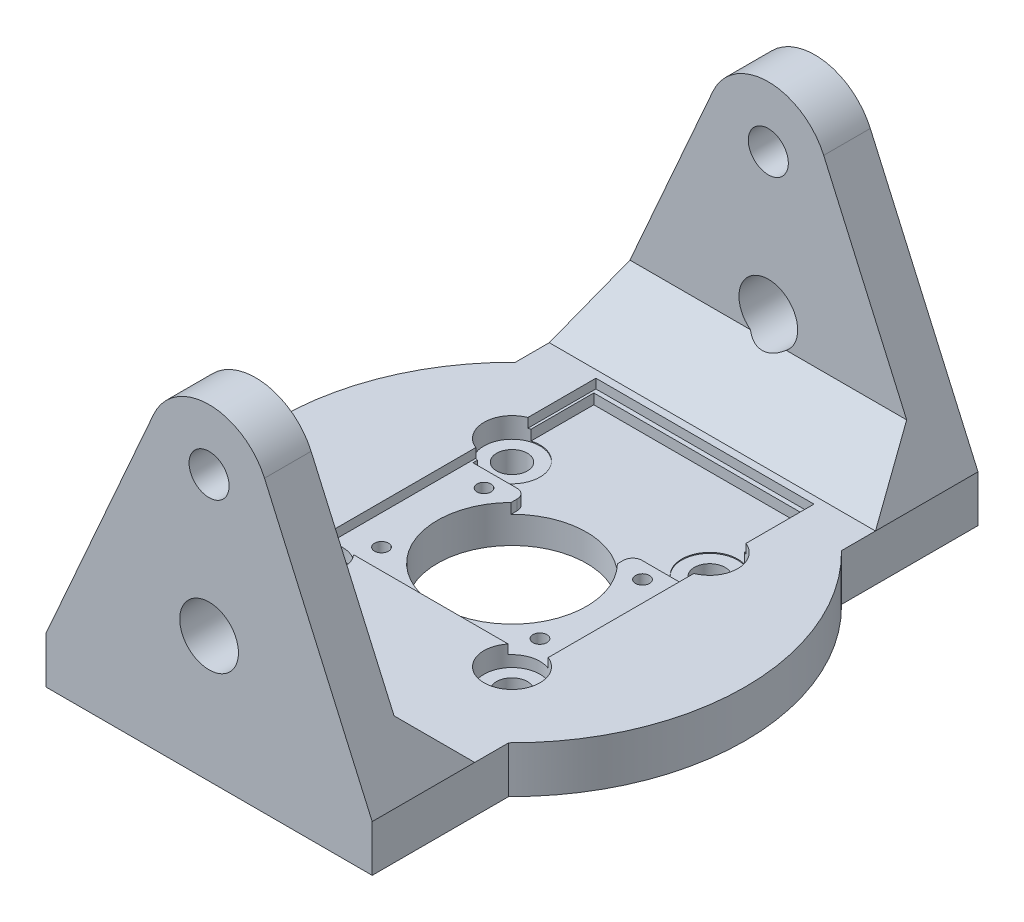
from build123d import *

# Parameters (mm, degrees)
SKETCH_1_R                = 25
SKETCH_1_R_2              = 8
SKETCH_1_R_3              = 1.65
EXTRUDE_1_DEPTH           = 5
SKETCH_5_W                = 23.4
SKETCH_5_H                = 29.4
CUT_EXTRUDE_1_DEPTH       = 1
SKETCH_6_R                = 3
CUT_EXTRUDE_2_DEPTH       = 2.2
CUT_EXTRUDE_3_REACH       = 37.581
SKETCH_9_R                = 0.75
CUT_EXTRUDE_START         = -1.1
CUT_EXTRUDE_4_DEPTH       = 1.1
EXTRUDE_3_DEPTH           = 5
SKETCH_13_W               = 35
SKETCH_13_H               = 5
EXTRUDE_4_DEPTH           = 30
CHAMFER_1_SIZE            = 6
CUT_EXTRUDE_START_2       = -65
CUT_EXTRUDE_5_OUTLINE_R   = 2.15
CUT_EXTRUDE_5_OUTLINE_R_2 = 3.15
CUT_EXTRUDE_5_DEPTH       = 65


# Read off the part's stored shape, not the designer's step: 切除-拉伸5
with BuildPart() as part:
    # 草图1 → 凸台-拉伸1 (new body)
    with BuildSketch(Plane(origin=(0, 0, 0), x_dir=(1, 0, 0), z_dir=(0, 1, 0))):
        with Locations(Location((0, 0, 0), (0, 0, 270))):
            Circle(SKETCH_1_R)
        with Locations(Location((0, 0, 0), (0, 0, 270))):
            Circle(SKETCH_1_R_2, mode=Mode.SUBTRACT)
        with Locations(Location((10.606601718, 10.606601718, 0), (0, 0, 270))):
            Circle(SKETCH_1_R_3, mode=Mode.SUBTRACT)
        with Locations(Location((-10.606601718, 10.606601718, 0), (0, 0, 270))):
            Circle(SKETCH_1_R_3, mode=Mode.SUBTRACT)
        with Locations(Location((-10.606601718, -10.606601718, 0), (0, 0, 270))):
            Circle(SKETCH_1_R_3, mode=Mode.SUBTRACT)
        with Locations(Location((10.606601718, -10.606601718, 0), (0, 0, 270))):
            Circle(SKETCH_1_R_3, mode=Mode.SUBTRACT)
    extrude(amount=EXTRUDE_1_DEPTH)

    # 草图5 → 切除-拉伸1 (cut)
    with BuildSketch(Plane(origin=(0, 5, 0), x_dir=(1, 0, 0), z_dir=(0, 1, 0))):
        with Locations((0, 6)):
            Rectangle(SKETCH_5_W, SKETCH_5_H)
    extrude(amount=-CUT_EXTRUDE_1_DEPTH, mode=Mode.SUBTRACT)

    # 草图6 → 切除-拉伸2 (cut)
    with BuildSketch(Plane(origin=(0, 5, 0), x_dir=(1, 0, 0), z_dir=(0, 1, 0))):
        with Locations(Location((-10.606601718, 10.606601718, 0), (0, 0, 270))):
            Circle(SKETCH_6_R)
        with Locations(Location((10.606601718, 10.606601718, 0), (0, 0, 270))):
            Circle(SKETCH_6_R)
        with Locations(Location((10.606601718, -10.606601718, 0), (0, 0, 270))):
            Circle(SKETCH_6_R)
        with Locations(Location((-10.606601718, -10.606601718, 0), (0, 0, 270))):
            Circle(SKETCH_6_R)
    extrude(amount=-CUT_EXTRUDE_2_DEPTH, mode=Mode.SUBTRACT)

    # 草图9 → 切除-拉伸3 (cut, up to next)
    with BuildSketch(Plane(origin=(0, 4, 0), x_dir=(1, 0, 0), z_dir=(0, 1, 0)), mode=Mode.PRIVATE) as cut_extrude_3_sk1:
        with Locations(Location((-8.5, 5.5, 0), (0, 0, 270))):
            Circle(SKETCH_9_R)
    cut_extrude_3_tool1 = extrude(cut_extrude_3_sk1.sketch, amount=-CUT_EXTRUDE_3_REACH, mode=Mode.PRIVATE) & part.part
    # 草图9 → 切除-拉伸3 (cut, up to next)
    with BuildSketch(Plane(origin=(0, 4, 0), x_dir=(1, 0, 0), z_dir=(0, 1, 0)), mode=Mode.PRIVATE) as cut_extrude_3_sk2:
        with Locations(Location((8.5, 5.5, 0), (0, 0, 270))):
            Circle(SKETCH_9_R)
    cut_extrude_3_tool2 = extrude(cut_extrude_3_sk2.sketch, amount=-CUT_EXTRUDE_3_REACH, mode=Mode.PRIVATE) & part.part
    # 草图9 → 切除-拉伸3 (cut, up to next)
    with BuildSketch(Plane(origin=(0, 4, 0), x_dir=(1, 0, 0), z_dir=(0, 1, 0)), mode=Mode.PRIVATE) as cut_extrude_3_sk3:
        with Locations(Location((8.5, -5.5, 0), (0, 0, 270))):
            Circle(SKETCH_9_R)
    cut_extrude_3_tool3 = extrude(cut_extrude_3_sk3.sketch, amount=-CUT_EXTRUDE_3_REACH, mode=Mode.PRIVATE) & part.part
    # 草图9 → 切除-拉伸3 (cut, up to next)
    with BuildSketch(Plane(origin=(0, 4, 0), x_dir=(1, 0, 0), z_dir=(0, 1, 0)), mode=Mode.PRIVATE) as cut_extrude_3_sk4:
        with Locations(Location((-8.5, -5.5, 0), (0, 0, 270))):
            Circle(SKETCH_9_R)
    cut_extrude_3_tool4 = extrude(cut_extrude_3_sk4.sketch, amount=-CUT_EXTRUDE_3_REACH, mode=Mode.PRIVATE) & part.part
    add(cut_extrude_3_tool1.solids().sort_by_distance((-8.5, 4, -5.5))[0], mode=Mode.SUBTRACT)
    add(cut_extrude_3_tool2.solids().sort_by_distance((8.5, 4, -5.5))[0], mode=Mode.SUBTRACT)
    add(cut_extrude_3_tool3.solids().sort_by_distance((8.5, 4, 5.5))[0], mode=Mode.SUBTRACT)
    add(cut_extrude_3_tool4.solids().sort_by_distance((-8.5, 4, 5.5))[0], mode=Mode.SUBTRACT)

    # 草图10 → 切除-拉伸4 (cut)
    with BuildSketch(Plane(origin=(0, 4, 0), x_dir=(1, 0, 0), z_dir=(0, 1, 0)).offset(CUT_EXTRUDE_START)):
        with BuildLine():
            Line((-5.700788223, 5.612576381), (-5.700788223, 6.246626792))
            ThreePointArc((-5.700788223, 6.246626792), (-5.993681442, 6.953733574), (-6.700788223, 7.246626792))
            Line((-6.700788223, 7.246626792), (-11.441421376, 7.246626792))
            Line((-11.441421376, 7.246626792), (-11.441421376, 20.219080974))
            Line((-11.441421376, 20.219080974), (11.441421376, 20.219080974))
            Line((11.441421376, 20.219080974), (11.441421376, 7.246626792))
            Line((11.441421376, 7.246626792), (6.700788223, 7.246626792))
            ThreePointArc((6.700788223, 7.246626792), (5.993681442, 6.953733574), (5.700788223, 6.246626792))
            Line((5.700788223, 6.246626792), (5.700788223, 5.612576381))
            ThreePointArc((5.700788223, 5.612576381), (0, 8), (-5.700788223, 5.612576381))
        make_face()
    extrude(amount=CUT_EXTRUDE_4_DEPTH, mode=Mode.SUBTRACT)

    # 草图12 → 凸台-拉伸3 (add)
    with BuildSketch(Plane.XZ):
        with BuildLine():
            Line((17.5, 17.853571071), (17.5, 32.5))
            Line((17.5, 32.5), (-17.5, 32.5))
            Line((-17.5, 32.5), (-17.5, 17.853571071))
            ThreePointArc((-17.5, 17.853571071), (0, 25), (17.5, 17.853571071))
        make_face()
        with BuildLine():
            Line((17.5, -32.5), (-17.5, -32.5))
            Line((-17.5, -32.5), (-17.5, -17.853571071))
            ThreePointArc((-17.5, -17.853571071), (0, -25), (17.5, -17.853571071))
            Line((17.5, -17.853571071), (17.5, -32.5))
        make_face()
    extrude(amount=-EXTRUDE_3_DEPTH)

    # 草图13 → 凸台-拉伸4 (add)
    with BuildSketch(Plane(origin=(0, 5, 0), x_dir=(1, 0, 0), z_dir=(0, 1, 0))):
        with Locations((0, 30)):
            Rectangle(SKETCH_13_W, SKETCH_13_H)
        with Locations((0, -30)):
            Rectangle(SKETCH_13_W, SKETCH_13_H)
    extrude(amount=EXTRUDE_4_DEPTH)

    # 倒角1
    chamfer_1_edges = [part.edges().sort_by_distance(p)[0] for p in [
        (0, 5, -27.5),
        (0, 5, 27.5),
    ]]
    chamfer(chamfer_1_edges, length=CHAMFER_1_SIZE)

    # 切除-拉伸5 outline → 切除-拉伸5 (cut)
    with BuildSketch(Plane.XY.offset(32.5).offset(CUT_EXTRUDE_START_2)):
        with BuildLine():
            ThreePointArc((-5.944619841, 31.128972222), (-3.546948023, 33.9469404), (0, 35))
            Line((0, 35), (-17.5, 35))
            Line((-17.5, 35), (-17.5, 5))
            Line((-17.5, 5), (-5.944619841, 31.128972222))
        make_face()
        with BuildLine():
            Line((5.944619841, 31.128972222), (17.5, 5))
            Line((17.5, 5), (17.5, 35))
            Line((17.5, 35), (0, 35))
            ThreePointArc((0, 35), (3.546948023, 33.9469404), (5.944619841, 31.128972222))
        make_face()
        with Locations((0, 28.5)):
            Circle(CUT_EXTRUDE_5_OUTLINE_R)
        with Locations((0, 13.5)):
            Circle(CUT_EXTRUDE_5_OUTLINE_R_2)
    extrude(amount=CUT_EXTRUDE_5_DEPTH, mode=Mode.SUBTRACT)


solid = part.part
